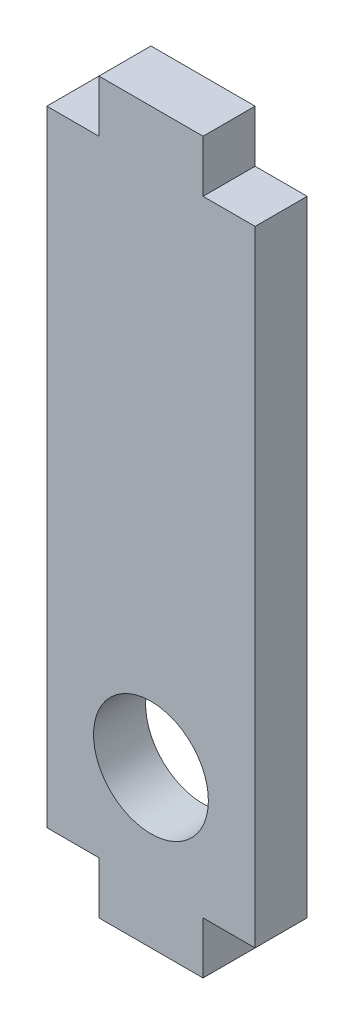
from build123d import *

# Parameters (mm, degrees)
BOSS_EXTRUDE1_DEPTH = 6.35
SKETCH2_R           = 6.99999997
CUT_EXTRUDE1_DEPTH  = 47.6627796


with BuildPart() as part:
    # Sketch1 → Boss-Extrude1 (new body)
    with BuildSketch(Plane.XY):
        Polygon((-12.7, 38.1), (-12.7, -38.1), (-6.35, -38.1), (-6.35, -44.45), (6.35, -44.45), (6.35, -38.1), (12.7, -38.1), (12.7, 38.1), (6.35, 38.1), (6.35, 44.45), (-6.35, 44.45), (-6.35, 38.1), align=None)
    extrude(amount=BOSS_EXTRUDE1_DEPTH)

    # Sketch2 → Cut-Extrude1 (cut, through all)
    with BuildSketch(Plane.XY.offset(6.35)):
        with Locations((0, -25.4)):
            Circle(SKETCH2_R)
    extrude(amount=-CUT_EXTRUDE1_DEPTH, mode=Mode.SUBTRACT)


solid = part.part
